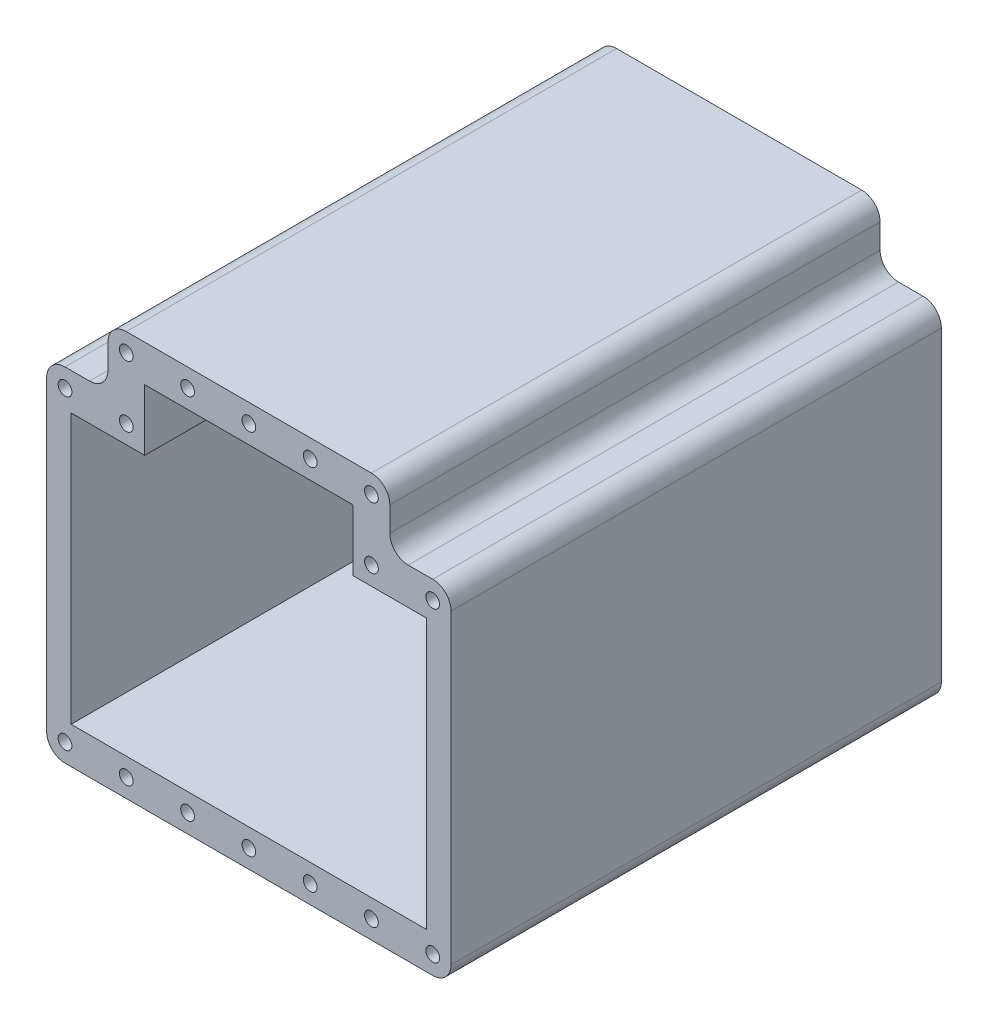
from build123d import *

# Parameters (mm, degrees)
BOSS_EXTRUDE1_DEPTH     = 200
CUT_EXTRUDE2_DEPTH      = 238.302549502
CUT_EXTRUDE2_DEPTH_BACK = 238.302549502
F_1_0MM_DOWEL_HOLE2_D   = 5.6


with BuildPart() as part:
    # Sketch2 → Boss-Extrude1 (new body)
    with BuildSketch(Plane.XY):
        with BuildLine():
            Line((-57.5, 60), (-57.5, 50))
            ThreePointArc((-57.5, 50), (-59.696699141, 44.696699141), (-65, 42.5))
            Line((-65, 42.5), (-75, 42.5))
            ThreePointArc((-75, 42.5), (-80.303300859, 40.303300859), (-82.5, 35))
            Line((-82.5, 35), (-82.5, -90))
            ThreePointArc((-82.5, -90), (-80.303300859, -95.303300859), (-75, -97.5))
            Line((-75, -97.5), (75, -97.5))
            ThreePointArc((75, -97.5), (80.303300859, -95.303300859), (82.5, -90))
            Line((82.5, -90), (82.5, 35))
            ThreePointArc((82.5, 35), (80.303300859, 40.303300859), (75, 42.5))
            Line((75, 42.5), (65, 42.5))
            ThreePointArc((65, 42.5), (59.696699141, 44.696699141), (57.5, 50))
            Line((57.5, 50), (57.5, 60))
            ThreePointArc((57.5, 60), (55.303300859, 65.303300859), (50, 67.5))
            Line((50, 67.5), (-50, 67.5))
            ThreePointArc((-50, 67.5), (-55.303300859, 65.303300859), (-57.5, 60))
        make_face()
    extrude(amount=-BOSS_EXTRUDE1_DEPTH)

    # Sketch8 → Cut-Extrude2 (cut, two sides: drawn at the far end of the back side and taken through both)
    with BuildSketch(Plane.XY.offset(-CUT_EXTRUDE2_DEPTH_BACK)):
        Polygon((-72.5, 27.5), (-42.5, 27.5), (-42.5, 52.5), (42.5, 52.5), (42.5, 27.5), (72.5, 27.5), (72.5, -82.5), (-72.5, -82.5), align=None)
    extrude(amount=CUT_EXTRUDE2_DEPTH + CUT_EXTRUDE2_DEPTH_BACK, mode=Mode.SUBTRACT)

    # Ø1.0mm Dowel Hole2 (through all)
    with Locations(Plane.XY):
        with Locations((75, -90), (-25, 60), (-75, 35), (-50, 35), (-50, 60), (50, 60), (50, 35), (75, 35), (0, 60), (25, 60), (-75, -90), (-50, -90), (-25, -90), (0, -90), (25, -90), (50, -90)):
            Hole(F_1_0MM_DOWEL_HOLE2_D / 2)


solid = part.part
